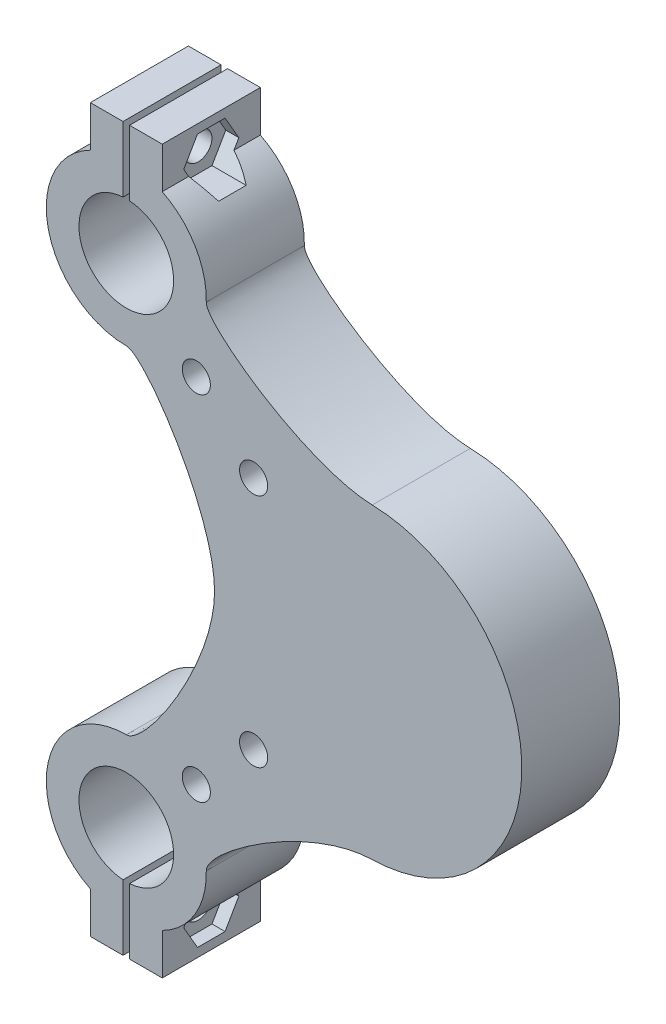
from build123d import *

# Parameters (mm, degrees)
SKETCH1_R               = 23.5
SKETCH1_R_2             = 18.5
BOSS_EXTRUDE1_DEPTH     = 7
SKETCH2_R               = 23.5
SKETCH2_R_2             = 15
BOSS_EXTRUDE2_DEPTH     = 3
SKETCH3_R               = 23.5
BOSS_EXTRUDE3_DEPTH     = 5
BOSS_EXTRUDE4_DEPTH     = 15
CUT_EXTRUDE1_DEPTH      = 88.358719822
CUT_EXTRUDE1_DEPTH_BACK = 88.358719822
SKETCH5_R               = 2.1
CUT_EXTRUDE2_DEPTH      = 88.35871984
CUT_EXTRUDE2_DEPTH_BACK = 2
SKETCH6_R               = 3.65
CUT_EXTRUDE3_DEPTH      = 80.375978306
CUT_EXTRUDE3_DEPTH_BACK = 2
BOSS_EXTRUDE6_START     = -15
BOSS_EXTRUDE6_DEPTH     = 15
SKETCH9_R               = 2.15
CUT_EXTRUDE4_DEPTH      = 15
CUT_EXTRUDE5_DEPTH      = 5
SKETCH11_W              = 94.20005325
SKETCH11_H              = 33.320618951
CUT_EXTRUDE6_DEPTH      = 25


# Read off the part's stored shape, not the designer's step: Boss-Extrude6
with BuildPart() as part:
    # Sketch1 → Boss-Extrude1 (new body)
    with BuildSketch(Plane.XY):
        Circle(SKETCH1_R)
        Circle(SKETCH1_R_2, mode=Mode.SUBTRACT)
    extrude(amount=BOSS_EXTRUDE1_DEPTH)

    # Sketch2 → Boss-Extrude2 (add)
    with BuildSketch(Plane.XY.offset(7)):
        Circle(SKETCH2_R)
        Circle(SKETCH2_R_2, mode=Mode.SUBTRACT)
    extrude(amount=BOSS_EXTRUDE2_DEPTH)

    # Sketch3 → Boss-Extrude3 (add)
    with BuildSketch(Plane.XY.offset(10)):
        Circle(SKETCH3_R)
    extrude(amount=BOSS_EXTRUDE3_DEPTH)



with BuildPart() as body_2:
    # Sketch4 → Boss-Extrude4 (new body)
    with BuildSketch(Plane.XY.offset(15)):
        with BuildLine():
            Line((-37.5, 45.221711778), (-37.5, 55.231747474))
            Line((-37.5, 55.231747474), (-42.5, 55.231747474))
            Line((-42.5, 55.231747474), (-42.5, 48.933577685))
            ThreePointArc((-42.5, 48.933577685), (-37, 25.761), (-31.5, 48.933577685))
            Line((-31.5, 48.933577685), (-31.5, 55.231747474))
            Line((-31.5, 55.231747474), (-36.5, 55.231747474))
            Line((-36.5, 55.231747474), (-36.5, 45.221711778))
            ThreePointArc((-36.5, 45.221711778), (-37, 30.761), (-37.5, 45.221711778))
        make_face()
    extrude(amount=-BOSS_EXTRUDE4_DEPTH)

    # Sketch5 → Cut-Extrude1 (cut, two sides: drawn at the far end of the back side and taken through both)
    with BuildSketch(Plane.ZY.offset(42.5).offset(-CUT_EXTRUDE1_DEPTH_BACK)):
        with Locations(Location((7.5, 50.231747474, 0), (0, 0, 321.816935122))):
            Circle(SKETCH5_R)
    extrude(amount=CUT_EXTRUDE1_DEPTH + CUT_EXTRUDE1_DEPTH_BACK, mode=Mode.SUBTRACT)

    # Sketch6 → Cut-Extrude2 (cut, two sides: drawn at the far end of the back side and taken through both)
    with BuildSketch(Plane.ZY.offset(42.5).offset(-CUT_EXTRUDE2_DEPTH_BACK)):
        with Locations(Location((7.5, 50.231747474, 0), (0, 0, 200.834080871))):
            Circle(SKETCH6_R)
    extrude(amount=CUT_EXTRUDE2_DEPTH + CUT_EXTRUDE2_DEPTH_BACK, mode=Mode.SUBTRACT)

    # Sketch7 → Cut-Extrude3 (cut, two sides: drawn at the far end of the back side and taken through both)
    with BuildSketch(Plane(origin=(-31.5, 0, 0), x_dir=(0, 0, -1), z_dir=(1, 0, 0)).offset(-CUT_EXTRUDE3_DEPTH_BACK)):
        Polygon((-5.392671517, 53.881747474), (-9.607328483, 53.881747474), (-11.714656965, 50.231747474), (-9.607328483, 46.581747474), (-5.392671517, 46.581747474), (-3.285343035, 50.231747474), align=None)
    extrude(amount=CUT_EXTRUDE3_DEPTH + CUT_EXTRUDE3_DEPTH_BACK, mode=Mode.SUBTRACT)


with BuildPart() as part_1:
    add(part.part)

    add(body_2.part)  # Boss-Extrude6 merges body 2
    # Boss-Extrude6 outline → Boss-Extrude6 (add)
    with BuildSketch(Plane.XY.offset(15).offset(BOSS_EXTRUDE6_START)):
        with BuildLine():
            ThreePointArc((-24.765350871, 37.673684678), (-28.461869415, 29.231109129), (-37, 25.761))
            add(Edge.make_bspline(
                [(-37, 25.761), (-34, 25.761), (-23.5, 10), (-23.5, 0)],
                knots=[0, 0, 0, 0, 1, 1, 1, 1], degree=3))
            ThreePointArc((-23.5, 0), (-16.393992054, 16.83707292), (0.626555279, 23.49164593))
            add(Edge.make_bspline(
                [(-24.765350871, 37.673684678), (-24.845336651, 34.674751155), (-9.369889797, 23.758265197), (0.626555279, 23.49164593)],
                knots=[0, 0, 0, 0, 1, 1, 1, 1], degree=3))
        make_face()
    extrude(amount=BOSS_EXTRUDE6_DEPTH)

    # Sketch9 → Cut-Extrude4 (cut)
    with BuildSketch(Plane.XY.offset(15)):
        with Locations((-17.526315789, 18)):
            Circle(SKETCH9_R)
        with Locations((-26.289473684, 27)):
            Circle(SKETCH9_R)
    extrude(amount=-CUT_EXTRUDE4_DEPTH, mode=Mode.SUBTRACT)

    # Sketch10 → Cut-Extrude5 (cut)
    with BuildSketch(Plane(origin=(0, 0, 0), x_dir=(-1, 0, 0), z_dir=(0, 0, -1))):
        Polygon((25.253012932, 22.914772657), (29.309153967, 24.059784987), (30.345614719, 28.14501233), (27.325934436, 31.085227343), (23.269793401, 29.940215013), (22.233332649, 25.85498767), align=None)
        Polygon((16.489855038, 13.914772657), (20.545996073, 15.059784987), (21.582456825, 19.14501233), (18.562776541, 22.085227343), (14.506635506, 20.940215013), (13.470174754, 16.85498767), align=None)
    extrude(amount=-CUT_EXTRUDE5_DEPTH, mode=Mode.SUBTRACT)

    # Sketch11 → Cut-Extrude6 (cut)
    with BuildSketch(Plane(origin=(0, 0, 0), x_dir=(1, 0, 0), z_dir=(0, 1, 0))):
        with Locations((-10.776769446, -9.973227019)):
            Rectangle(SKETCH11_W, SKETCH11_H)
    extrude(amount=-CUT_EXTRUDE6_DEPTH, mode=Mode.SUBTRACT)

    # Mirror4: part across plane


with BuildPart() as part_2:
    add(part_1.part)
    add(part_1.part.mirror(Plane.ZX))


solid = part_2.part
